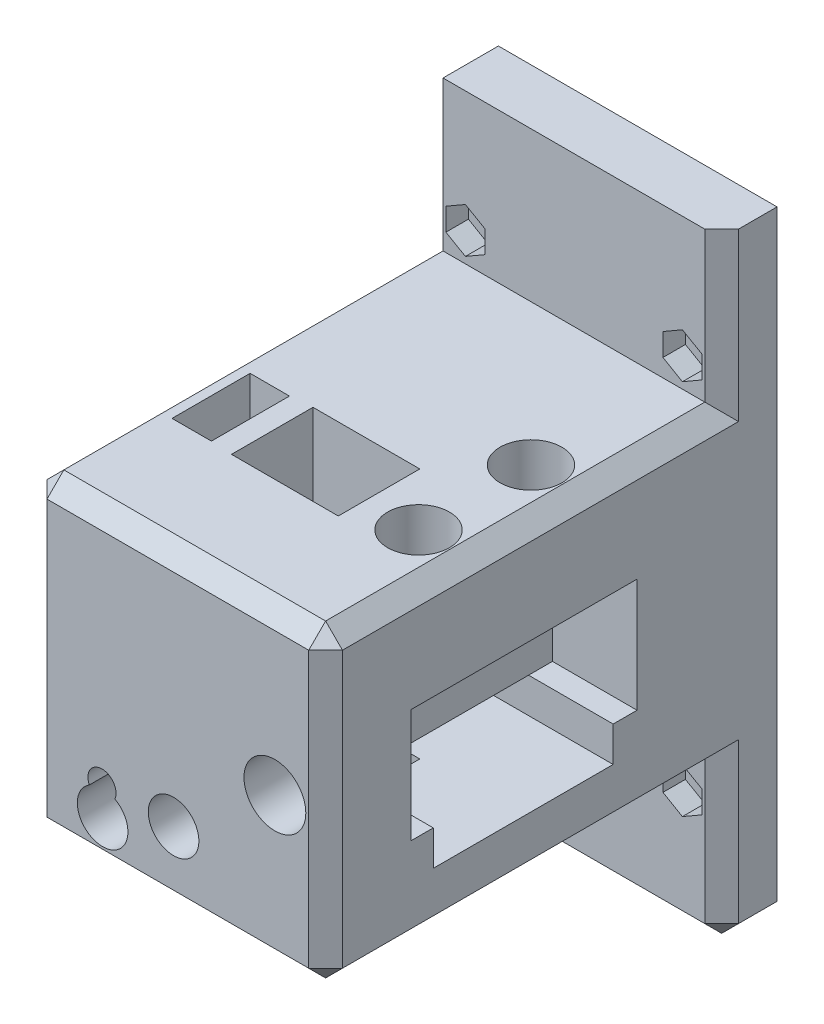
from build123d import *

# Parameters (mm, degrees)
SKETCH1_W                = 34.3
SKETCH1_H                = 70.3
SKETCH1_W_2              = 110
SKETCH1_H_2              = 9.85
BOSS_EXTRUDE1_DEPTH      = 15.048264774
BOSS_EXTRUDE3_DEPTH      = 10
BOSS_EXTRUDE4_DEPTH      = 27.518264774
CUT_EXTRUDE1_DEPTH       = 97.82308708
CUT_EXTRUDE1_DEPTH_BACK  = 97.82308708
SKETCH4_R                = 2
CUT_EXTRUDE3_DEPTH       = 77.2053469
CUT_EXTRUDE3_DEPTH_BACK  = 77.2053469
SKETCH8_W                = 129.903835659
SKETCH8_H                = 83.627886417
SKETCH9_W                = 44.357950904
SKETCH9_H                = 70.607950904
SKETCH9_W_2              = 20
SKETCH9_H_2              = 40
BOSS_EXTRUDE5_DEPTH      = 15.048264774
SKETCH10_W               = 20.2
SKETCH10_H               = 40.2
SKETCH10_W_2             = 20
SKETCH10_H_2             = 40
CUT_EXTRUDE6_DEPTH       = 81.359319258
SKETCH11_R               = 3
CUT_EXTRUDE7_DEPTH       = 30
CUT_EXTRUDE8_DEPTH       = 105.313703151
CUT_EXTRUDE8_DEPTH_BACK  = 8
SKETCH12_R               = 5.5
CUT_EXTRUDE10_DEPTH      = 81.359319258
CUT_EXTRUDE10_DEPTH_BACK = 81.359319258
SKETCH14_W               = 7.032197939
SKETCH14_H               = 32
SKETCH19_W               = 44.357950904
SKETCH19_H               = 70.453975452
BOSS_EXTRUDE9_DEPTH      = 3
BOSS_EXTRUDE6_DEPTH      = 19.3
SKETCH16_R               = 3.4
BOSS_EXTRUDE7_DEPTH      = 2.1
BOSS_EXTRUDE8_DEPTH      = 16.35
SKETCH20_R               = 3.4
BOSS_EXTRUDE10_DEPTH     = 0.5
SKETCH21_W               = 18.048264774
SKETCH21_H               = 5.321024548
BOSS_EXTRUDE11_DEPTH     = 14.5
BOSS_EXTRUDE12_START     = 0.5
SKETCH24_R               = 3.4
BOSS_EXTRUDE12_DEPTH     = 0.5
CUT_EXTRUDE11_START      = -0.25
SKETCH25_R               = 3.4
CUT_EXTRUDE11_DEPTH      = 0.25
SKETCH26_R               = 3.4
BOSS_EXTRUDE13_DEPTH     = 1
BOSS_EXTRUDE14_DEPTH     = 20.303975452
CUT_EXTRUDE12_DEPTH      = 4
SKETCH29_R               = 5.5
CUT_EXTRUDE13_DEPTH      = 8
SKETCH30_R               = 3
CUT_EXTRUDE14_DEPTH      = 26
CUT_EXTRUDE15_DEPTH      = 626.267941866
CUT_EXTRUDE15_DEPTH_BACK = 626.267941866
SKETCH31_W               = 192.459482296
SKETCH31_H               = 197.325031006
SKETCH31_W_2             = 7.003218593
SKETCH31_H_2             = 13.886852379
CUT_EXTRUDE16_DEPTH      = 626.668982681
CUT_EXTRUDE16_DEPTH_BACK = 626.668982681
SKETCH32_R               = 2.5
CUT_EXTRUDE17_DEPTH      = 626.668982681
CUT_EXTRUDE17_DEPTH_BACK = 16
SKETCH33_R               = 4.5
SKETCH34_R               = 4.5
CUT_EXTRUDE18_DEPTH      = 12
CUT_EXTRUDE19_DEPTH      = 20
CUT_EXTRUDE20_DEPTH      = 13


with BuildPart() as part:
    # Sketch1 → Boss-Extrude1 (new body)
    # profile 1 of 2: a face of its own
    with BuildSketch(Plane.YZ):
        Rectangle(SKETCH1_W, SKETCH1_H)
        with BuildLine():
            Line((-10.15, 6.7), (-10.15, -6.7))
            ThreePointArc((-10.15, -6.7), (-9.871751442, -7.371751442), (-9.2, -7.65))
            Line((-9.2, -7.65), (-8.5, -7.65))
            ThreePointArc((-8.5, -7.65), (-8.181801948, -7.518198052), (-8.05, -7.2))
            Line((-8.05, -7.2), (-8.05, -5.094911614))
            ThreePointArc((-8.05, -5.094911614), (-7.621019548, -4.452896997), (-6.863711672, -4.603534899))
            Line((-6.863711672, -4.603534899), (-4.684745674, -6.782500897))
            ThreePointArc((-4.684745674, -6.782500897), (-4.066943332, -7.707107441), (-3.85, -8.797755224))
            Line((-3.85, -8.797755224), (-3.85, -11.202244776))
            ThreePointArc((-3.85, -11.202244776), (-4.066943332, -12.292892559), (-4.684745674, -13.217499103))
            Line((-4.684745674, -13.217499103), (-6.863711672, -15.396465101))
            ThreePointArc((-6.863711672, -15.396465101), (-7.621019548, -15.547103003), (-8.05, -14.905088386))
            Line((-8.05, -14.905088386), (-8.05, -12.8))
            ThreePointArc((-8.05, -12.8), (-8.181801948, -12.481801948), (-8.5, -12.35))
            Line((-8.5, -12.35), (-9.2, -12.35))
            ThreePointArc((-9.2, -12.35), (-9.871751442, -12.628248558), (-10.15, -13.3))
            Line((-10.15, -13.3), (-10.15, -18))
            ThreePointArc((-10.15, -18), (-9.52027958, -19.52027958), (-8, -20.15))
            Line((-8, -20.15), (-3.3, -20.15))
            ThreePointArc((-3.3, -20.15), (-2.628248558, -19.871751442), (-2.35, -19.2))
            Line((-2.35, -19.2), (-2.35, -18.5))
            ThreePointArc((-2.35, -18.5), (-2.481801948, -18.181801948), (-2.8, -18.05))
            Line((-2.8, -18.05), (-4.905088386, -18.05))
            ThreePointArc((-4.905088386, -18.05), (-5.547103003, -17.621019548), (-5.396465101, -16.863711672))
            Line((-5.396465101, -16.863711672), (-3.217499103, -14.684745674))
            ThreePointArc((-3.217499103, -14.684745674), (-2.292892559, -14.066943332), (-1.202244776, -13.85))
            Line((-1.202244776, -13.85), (1.202244776, -13.85))
            ThreePointArc((1.202244776, -13.85), (2.292892559, -14.066943332), (3.217499103, -14.684745674))
            Line((3.217499103, -14.684745674), (5.396465101, -16.863711672))
            ThreePointArc((5.396465101, -16.863711672), (5.547103003, -17.621019548), (4.905088386, -18.05))
            Line((4.905088386, -18.05), (2.8, -18.05))
            ThreePointArc((2.8, -18.05), (2.481801948, -18.181801948), (2.35, -18.5))
            Line((2.35, -18.5), (2.35, -19.2))
            ThreePointArc((2.35, -19.2), (2.628248558, -19.871751442), (3.3, -20.15))
            Line((3.3, -20.15), (8, -20.15))
            ThreePointArc((8, -20.15), (9.52027958, -19.52027958), (10.15, -18))
            Line((10.15, -18), (10.15, -13.3))
            ThreePointArc((10.15, -13.3), (9.871751442, -12.628248558), (9.2, -12.35))
            Line((9.2, -12.35), (8.5, -12.35))
            ThreePointArc((8.5, -12.35), (8.181801948, -12.481801948), (8.05, -12.8))
            Line((8.05, -12.8), (8.05, -14.905088386))
            ThreePointArc((8.05, -14.905088386), (7.621019548, -15.547103003), (6.863711672, -15.396465101))
            Line((6.863711672, -15.396465101), (4.684745674, -13.217499103))
            ThreePointArc((4.684745674, -13.217499103), (4.066943332, -12.292892559), (3.85, -11.202244776))
            Line((3.85, -11.202244776), (3.85, -8.797755224))
            ThreePointArc((3.85, -8.797755224), (4.066943332, -7.707107441), (4.684745674, -6.782500897))
            Line((4.684745674, -6.782500897), (6.863711672, -4.603534899))
            ThreePointArc((6.863711672, -4.603534899), (7.621019548, -4.452896997), (8.05, -5.094911614))
            Line((8.05, -5.094911614), (8.05, -7.2))
            ThreePointArc((8.05, -7.2), (8.181801948, -7.518198052), (8.5, -7.65))
            Line((8.5, -7.65), (9.2, -7.65))
            ThreePointArc((9.2, -7.65), (9.871751442, -7.371751442), (10.15, -6.7))
            Line((10.15, -6.7), (10.15, 6.7))
            ThreePointArc((10.15, 6.7), (9.871751442, 7.371751442), (9.2, 7.65))
            Line((9.2, 7.65), (8.5, 7.65))
            ThreePointArc((8.5, 7.65), (8.181801948, 7.518198052), (8.05, 7.2))
            Line((8.05, 7.2), (8.05, 5.094911614))
            ThreePointArc((8.05, 5.094911614), (7.621019548, 4.452896997), (6.863711672, 4.603534899))
            Line((6.863711672, 4.603534899), (4.684745674, 6.782500897))
            ThreePointArc((4.684745674, 6.782500897), (4.066943332, 7.707107441), (3.85, 8.797755224))
            Line((3.85, 8.797755224), (3.85, 11.202244776))
            ThreePointArc((3.85, 11.202244776), (4.066943332, 12.292892559), (4.684745674, 13.217499103))
            Line((4.684745674, 13.217499103), (6.863711672, 15.396465101))
            ThreePointArc((6.863711672, 15.396465101), (7.621019548, 15.547103003), (8.05, 14.905088386))
            Line((8.05, 14.905088386), (8.05, 12.8))
            ThreePointArc((8.05, 12.8), (8.181801948, 12.481801948), (8.5, 12.35))
            Line((8.5, 12.35), (9.2, 12.35))
            ThreePointArc((9.2, 12.35), (9.871751442, 12.628248558), (10.15, 13.3))
            Line((10.15, 13.3), (10.15, 18))
            ThreePointArc((10.15, 18), (9.52027958, 19.52027958), (8, 20.15))
            Line((8, 20.15), (3.3, 20.15))
            ThreePointArc((3.3, 20.15), (2.628248558, 19.871751442), (2.35, 19.2))
            Line((2.35, 19.2), (2.35, 18.5))
            ThreePointArc((2.35, 18.5), (2.481801948, 18.181801948), (2.8, 18.05))
            Line((2.8, 18.05), (4.905088386, 18.05))
            ThreePointArc((4.905088386, 18.05), (5.547103003, 17.621019548), (5.396465101, 16.863711672))
            Line((5.396465101, 16.863711672), (3.217499103, 14.684745674))
            ThreePointArc((3.217499103, 14.684745674), (2.292892559, 14.066943332), (1.202244776, 13.85))
            Line((1.202244776, 13.85), (-1.202244776, 13.85))
            ThreePointArc((-1.202244776, 13.85), (-2.292892559, 14.066943332), (-3.217499103, 14.684745674))
            Line((-3.217499103, 14.684745674), (-5.396465101, 16.863711672))
            ThreePointArc((-5.396465101, 16.863711672), (-5.547103003, 17.621019548), (-4.905088386, 18.05))
            Line((-4.905088386, 18.05), (-2.8, 18.05))
            ThreePointArc((-2.8, 18.05), (-2.481801948, 18.181801948), (-2.35, 18.5))
            Line((-2.35, 18.5), (-2.35, 19.2))
            ThreePointArc((-2.35, 19.2), (-2.628248558, 19.871751442), (-3.3, 20.15))
            Line((-3.3, 20.15), (-8, 20.15))
            ThreePointArc((-8, 20.15), (-9.52027958, 19.52027958), (-10.15, 18))
            Line((-10.15, 18), (-10.15, 13.3))
            ThreePointArc((-10.15, 13.3), (-9.871751442, 12.628248558), (-9.2, 12.35))
            Line((-9.2, 12.35), (-8.5, 12.35))
            ThreePointArc((-8.5, 12.35), (-8.181801948, 12.481801948), (-8.05, 12.8))
            Line((-8.05, 12.8), (-8.05, 14.905088386))
            ThreePointArc((-8.05, 14.905088386), (-7.621019548, 15.547103003), (-6.863711672, 15.396465101))
            Line((-6.863711672, 15.396465101), (-4.684745674, 13.217499103))
            ThreePointArc((-4.684745674, 13.217499103), (-4.066943332, 12.292892559), (-3.85, 11.202244776))
            Line((-3.85, 11.202244776), (-3.85, 8.797755224))
            ThreePointArc((-3.85, 8.797755224), (-4.066943332, 7.707107441), (-4.684745674, 6.782500897))
            Line((-4.684745674, 6.782500897), (-6.863711672, 4.603534899))
            ThreePointArc((-6.863711672, 4.603534899), (-7.621019548, 4.452896997), (-8.05, 5.094911614))
            Line((-8.05, 5.094911614), (-8.05, 7.2))
            ThreePointArc((-8.05, 7.2), (-8.181801948, 7.518198052), (-8.5, 7.65))
            Line((-8.5, 7.65), (-9.2, 7.65))
            ThreePointArc((-9.2, 7.65), (-9.871751442, 7.371751442), (-10.15, 6.7))
        make_face(mode=Mode.SUBTRACT)
    # profile 2 of 2: a face of its own
    with BuildSketch(Plane.YZ):
        with Locations((0, -40.075)):
            Rectangle(SKETCH1_W_2, SKETCH1_H_2)
    extrude(amount=-BOSS_EXTRUDE1_DEPTH)

    # Sketch2 → Boss-Extrude3 (add)
    with BuildSketch(Plane.YZ):
        Polygon((17.15, 35.15), (-17.15, 35.15), (-17.15, -35.15), (-55, -35.15), (-55, -45), (55, -45), (55, -35.15), (17.15, -35.15), align=None)
    extrude(amount=BOSS_EXTRUDE3_DEPTH)

    # Sketch3 → Boss-Extrude4 (add)
    with BuildSketch(Plane.YZ.offset(10)):
        Polygon((-17.15, -35.15), (17.15, -35.15), (55, -35.15), (55, -45), (-55, -45), (-55, -35.15), align=None)
    extrude(amount=BOSS_EXTRUDE4_DEPTH)

    # Sketch4 → Cut-Extrude1 (cut, two sides: drawn at the far end of the back side and taken through both)
    with BuildSketch(Plane.XY.offset(-35.15).offset(-CUT_EXTRUDE1_DEPTH_BACK)):
        with Locations((-8.06818722, 33.5)):
            Circle(SKETCH4_R)
        with Locations((-8.06818722, -33.5)):
            Circle(SKETCH4_R)
        with Locations((30.53818722, -33.5)):
            Circle(SKETCH4_R)
        with Locations((30.53818722, 33.5)):
            Circle(SKETCH4_R)
    extrude(amount=CUT_EXTRUDE1_DEPTH + CUT_EXTRUDE1_DEPTH_BACK, mode=Mode.SUBTRACT)

    # Sketch8 → Cut-Extrude3 (cut, two sides: drawn at the far end of the back side and taken through both)
    with BuildSketch(Plane.YZ.offset(10).offset(-CUT_EXTRUDE3_DEPTH_BACK)):
        with Locations((-9.95191783, 6.663943208)):
            Rectangle(SKETCH8_W, SKETCH8_H)
    extrude(amount=CUT_EXTRUDE3_DEPTH + CUT_EXTRUDE3_DEPTH_BACK, mode=Mode.SUBTRACT)

    # Sketch9 → Boss-Extrude5 (add)
    with BuildSketch(Plane(origin=(-15.048264774, 0, 0), x_dir=(0, -1, 0), z_dir=(-1, 0, 0))):
        with Locations((-0.848975452, 0)):
            Rectangle(SKETCH9_W, SKETCH9_H)
        Rectangle(SKETCH9_W_2, SKETCH9_H_2, mode=Mode.SUBTRACT)
    extrude(amount=-BOSS_EXTRUDE5_DEPTH)

    # Sketch10 → Cut-Extrude6 (cut, through all)
    with BuildSketch(Plane.YZ):
        Rectangle(SKETCH10_W, SKETCH10_H)
        Rectangle(SKETCH10_W_2, SKETCH10_H_2, mode=Mode.SUBTRACT)
    extrude(amount=-CUT_EXTRUDE6_DEPTH, mode=Mode.SUBTRACT)

    # Sketch11 → Cut-Extrude7 (cut)
    with BuildSketch(Plane.XY.offset(35.303975452)):
        with Locations((-6.024132387, 0)):
            Circle(SKETCH11_R)
    extrude(amount=-CUT_EXTRUDE7_DEPTH, mode=Mode.SUBTRACT)

    # Sketch12 → Cut-Extrude8 (cut, two sides: drawn at the far end of the back side and taken through both)
    with BuildSketch(Plane.XY.offset(35.303975452).offset(-CUT_EXTRUDE8_DEPTH_BACK)):
        with Locations((-6.024132387, 0)):
            Circle(SKETCH12_R)
    extrude(amount=CUT_EXTRUDE8_DEPTH + CUT_EXTRUDE8_DEPTH_BACK, mode=Mode.SUBTRACT)

    # Sketch14 → Cut-Extrude10 (cut, two sides: drawn at the far end of the back side and taken through both)
    with BuildSketch(Plane.YZ.offset(-CUT_EXTRUDE10_DEPTH_BACK)):
        with Locations((-12.813901031, 0.15)):
            Rectangle(SKETCH14_W, SKETCH14_H)
    extrude(amount=CUT_EXTRUDE10_DEPTH + CUT_EXTRUDE10_DEPTH_BACK, mode=Mode.SUBTRACT)

    # Sketch19 → Boss-Extrude9 (add)
    # profile 1 of 2: a face of its own
    with BuildSketch(Plane.YZ):
        with Locations((0.848975452, 0.076987726)):
            Rectangle(SKETCH19_W, SKETCH19_H)
        Polygon((-16.33, -15.85), (-16.33, 16.15), (-10.1, 16.15), (-10.1, 20.1), (10.1, 20.1), (10.1, -20.1), (-10.1, -20.1), (-10.1, -15.85), align=None, mode=Mode.SUBTRACT)
    # profile 2 of 2: a face of its own
    with BuildSketch(Plane.YZ):
        Polygon((-10.1, 16.15), (-10.1, -15.85), (-10.1, -20.1), (10.1, -20.1), (10.1, 20.1), (-10.1, 20.1), align=None)
    extrude(amount=BOSS_EXTRUDE9_DEPTH)

    # Sketch15 → Boss-Extrude6 (add)
    with BuildSketch(Plane.XY.offset(-35.15)):
        Polygon((37.518264774, 28.348975452), (-15.048264774, 28.348975452), (-15.048264774, 23.027950904), (3, 23.027950904), (3, -21.33), (-15.048264774, -21.33), (-15.048264774, -26.651024548), (37.518264774, -26.651024548), align=None)
    extrude(amount=BOSS_EXTRUDE6_DEPTH)

    # Sketch16 → Boss-Extrude7 (add)
    with BuildSketch(Plane.XY.offset(-15.85)):
        with Locations(Location((24.73, -13.83, 0), (0, 0, 180))):
            Circle(SKETCH16_R)
    extrude(amount=BOSS_EXTRUDE7_DEPTH)

    # Sketch18 → Boss-Extrude8 (add)
    with BuildSketch(Plane.XY.offset(-15.85)):
        Polygon((14.73, -16.33), (3, -16.33), (3, -21.33), (-15.048264774, -21.33), (-15.048264774, -26.651024548), (14.73, -26.651024548), (14.73, -18.73), align=None)
        with BuildLine():
            Line((3, 23.027950904), (3, -10.1))
            Line((3, -10.1), (24.091429665, -8.750409431))
            ThreePointArc((24.091429665, -8.750409431), (31.571574988, -11.43665703), (34.73, -18.73))
            Line((34.73, -18.73), (34.73, -26.651024548))
            Line((34.73, -26.651024548), (37.518264774, -26.651024548))
            Line((37.518264774, -26.651024548), (37.518264774, 28.348975452))
            Line((37.518264774, 28.348975452), (-15.048264774, 28.348975452))
            Line((-15.048264774, 28.348975452), (-15.048264774, 23.027950904))
            Line((-15.048264774, 23.027950904), (3, 23.027950904))
        make_face()
    extrude(amount=BOSS_EXTRUDE8_DEPTH)

    # Sketch20 → Boss-Extrude10 (add)
    with BuildSketch(Plane.XY.offset(0.5)):
        with Locations(Location((12, -28.33, 0), (0, 0, 150.408273311))):
            Circle(SKETCH20_R)
    extrude(amount=BOSS_EXTRUDE10_DEPTH)

    # Sketch21 → Boss-Extrude11 (add)
    with BuildSketch(Plane.XY.offset(0.5)):
        with BuildLine():
            Line((22, 28.348975452), (22, -8.884235056))
            Line((22, -8.884235056), (24.091429665, -8.750409431))
            ThreePointArc((24.091429665, -8.750409431), (31.571574988, -11.43665703), (34.73, -18.73))
            Line((34.73, -18.73), (34.73, -26.651024548))
            Line((34.73, -26.651024548), (37.518264774, -26.651024548))
            Line((37.518264774, -26.651024548), (37.518264774, 28.348975452))
            Line((37.518264774, 28.348975452), (22, 28.348975452))
        make_face()
        with BuildLine():
            Line((-15.048264774, -26.651024548), (2.141955497, -26.651024548))
            ThreePointArc((2.141955497, -26.651024548), (3.136652725, -23.69954915), (4.991150442, -21.197256637))
            Line((4.991150442, -21.197256637), (3, -16.33))
            Line((3, -16.33), (3, -21.33))
            Line((3, -21.33), (-15.048264774, -21.33))
            Line((-15.048264774, -21.33), (-15.048264774, -26.651024548))
        make_face()
        with Locations((-6.024132387, 25.688463178)):
            Rectangle(SKETCH21_W, SKETCH21_H)
    extrude(amount=BOSS_EXTRUDE11_DEPTH)

    # Sketch25 → Cut-Extrude11 (cut)
    with BuildSketch(Plane.XY.offset(-13.75).offset(CUT_EXTRUDE11_START)):
        with Locations(Location((24.73, -13.83, 0), (0, 0, 180))):
            Circle(SKETCH25_R)
    extrude(amount=CUT_EXTRUDE11_DEPTH, mode=Mode.SUBTRACT)



with BuildPart() as body_2:
    # Sketch24 → Boss-Extrude12 (new body)
    with BuildSketch(Plane.YX.offset(-0.5).offset(BOSS_EXTRUDE12_START)):
        with Locations(Location((-13.83, 24.73, 0), (0, 0, 270))):
            Circle(SKETCH24_R)
    extrude(amount=-BOSS_EXTRUDE12_DEPTH)


with BuildPart() as body_3:
    # Sketch26 → Boss-Extrude13 (new body)
    with BuildSketch(Plane(origin=(0, 0, 14), x_dir=(0, -1, 0), z_dir=(0, 0, 1))):
        with Locations(Location((28.33, 12, 0), (0, 0, 240.408273311))):
            Circle(SKETCH26_R)
    extrude(amount=BOSS_EXTRUDE13_DEPTH)


with BuildPart() as part_1:
    add(part.part)

    add(body_3.part)  # Boss-Extrude14 merges body 3
    # Sketch27 → Boss-Extrude14 (add)
    with BuildSketch(Plane.XY.offset(15)):
        Polygon((-15.048264774, -21.33), (-15.048264774, -26.651024548), (37.518264774, -26.651024548), (37.518264774, 28.348975452), (-15.048264774, 28.348975452), (-15.048264774, 23.027950904), (3, 23.027950904), (3, -21.33), align=None)
    extrude(amount=BOSS_EXTRUDE14_DEPTH)

    # Chamfer1
    # the kernel refuses this chamfer: 3 mm, written as the material it takes off along each edge
    with BuildSketch(Plane(origin=(-13.048264774, 26.348975452, 33.303975452), x_dir=(0.7071067812061043, 0.7071067811669909, 0), z_dir=(-0.5773502691639131, 0.577350269195849, 0.5773502692091153)), Plane(origin=(35.518264774, 26.348975452, 33.303975452), x_dir=(0.707106781206494, -0.707106781166601, 0), z_dir=(0.5773502691634868, 0.5773502691960591, 0.5773502692093315)), Plane(origin=(-13.048264774, -24.651024548, 33.303975452), x_dir=(0.707106781214228, 0, 0.7071067811588669), z_dir=(-0.5773502691639134, -0.5773502691958485, 0.5773502692091155)), Plane(origin=(-13.048264774, -53, -37.15), x_dir=(0, -0.7071067811865467, -0.7071067811865483), z_dir=(-0.5773502691896262, -0.5773502691896262, 0.5773502691896248))) as chamfer1_piece_1:
        Polygon((-2.121320344, 1.224744871), (2.121320344, 1.224744871), (0, -2.449489743), align=None)
    extrude(amount=3.810511777, mode=Mode.SUBTRACT)
    with BuildSketch(Plane(origin=(35.518264774, -24.651024548, 33.303975452), x_dir=(-0.7071067812146217, 0, 0.7071067811584735), z_dir=(0.5773502691634868, -0.5773502691960591, 0.5773502692093315)), Plane(origin=(35.518264774, -53, -37.15), x_dir=(0, -0.7071067811865467, -0.7071067811865483), z_dir=(0.5773502691896262, -0.5773502691896262, 0.5773502691896248))) as chamfer1_piece_2:
        Polygon((-2.121320344, -1.224744871), (2.121320344, -1.224744871), (0, 2.449489743), align=None)
    extrude(amount=3.810511777, mode=Mode.SUBTRACT)
    with BuildSketch(Plane(origin=(-15.048264774, 28.348975452, -35.15), x_dir=(-0.02749587661058619, 0, -0.9996219169112968), z_dir=(0, 1, 0))) as chamfer1_piece_3:
        with BuildLine():
            Line((3.086019586, 0), (-0.169641465, -3.081353381))
            Line((-0.169641465, -3.081353381), (-0.22961878, -3.079703628))
            ThreePointArc((-0.22961878, -3.079703628), (-0.102387681, -1.540193489), (-0.059977315, 0.001649753))
            Line((-0.059977315, 0.001649753), (0.001649753, 0.059977315))
            ThreePointArc((0.001649753, 0.059977315), (1.543492994, 0.017566949), (3.087669338, 0.059977315))
            Line((3.087669338, 0.059977315), (3.086019586, 0))
        make_face()
    extrude(amount=34.366073512, mode=Mode.SUBTRACT)
    with BuildSketch(Plane(origin=(-15.048264774, 28.348975452, 43.019024416), x_dir=(-0.02749587661058619, -0.9996219169112968, 0), z_dir=(0, 0, -1)), Plane(origin=(37.518264774, 28.348975452, -35.15), x_dir=(0.027495876666186494, -0.9996219169097673, 0), z_dir=(0, 0, 1)), Plane(origin=(37.518264774, -26.651024548, 43.019024416), x_dir=(0.027495876610586768, 0.9996219169112968, 0), z_dir=(0, 0, -1)), Plane(origin=(-15.048264774, -26.651024548, -35.15), x_dir=(-0.027495876665117977, 0.9996219169097968, 0), z_dir=(0, 0, 1))) as chamfer1_piece_4:
        with BuildLine():
            Line((3.086019586, 0), (-0.169641465, -3.081353381))
            Line((-0.169641465, -3.081353381), (-0.22961878, -3.079703628))
            ThreePointArc((-0.22961878, -3.079703628), (-0.102387681, -1.540193489), (-0.059977315, 0.001649753))
            Line((-0.059977315, 0.001649753), (0.001649753, 0.059977315))
            ThreePointArc((0.001649753, 0.059977315), (1.543492994, 0.017566949), (3.087669338, 0.059977315))
            Line((3.087669338, 0.059977315), (3.086019586, 0))
        make_face()
    extrude(amount=78.169024416, mode=Mode.SUBTRACT)
    with BuildSketch(Plane(origin=(-22.763313738, -26.651024548, 35.303975452), x_dir=(0, 0.9996219169112965, 0.02749587661058676), z_dir=(1, 0, 0))) as chamfer1_piece_5:
        with BuildLine():
            Line((3.086019586, 0), (-0.169641465, -3.081353381))
            Line((-0.169641465, -3.081353381), (-0.22961878, -3.079703628))
            ThreePointArc((-0.22961878, -3.079703628), (-0.102387681, -1.540193489), (-0.059977315, 0.001649753))
            Line((-0.059977315, 0.001649753), (0.001649753, 0.059977315))
            ThreePointArc((0.001649753, 0.059977315), (1.543492994, 0.017566949), (3.087669338, 0.059977315))
            Line((3.087669338, 0.059977315), (3.086019586, 0))
        make_face()
    extrude(amount=67.996627475, mode=Mode.SUBTRACT)
    with BuildSketch(Plane(origin=(45.233313738, 28.348975452, 35.303975452), x_dir=(0, 0.027495876610586768, -0.9996219169112968), z_dir=(-1, 0, 0))) as chamfer1_piece_6:
        with BuildLine():
            Line((3.086019586, 0), (-0.169641465, 3.081353381))
            Line((-0.169641465, 3.081353381), (-0.22961878, 3.079703628))
            ThreePointArc((-0.22961878, 3.079703628), (-0.102387681, 1.540193489), (-0.059977315, -0.001649753))
            Line((-0.059977315, -0.001649753), (0.001649753, -0.059977315))
            ThreePointArc((0.001649753, -0.059977315), (1.543492994, -0.017566949), (3.087669338, -0.059977315))
            Line((3.087669338, -0.059977315), (3.086019586, 0))
        make_face()
    extrude(amount=67.996627475, mode=Mode.SUBTRACT)
    with BuildSketch(Plane(origin=(45.233313738, -55, -35.15), x_dir=(0, -0.027495876610586768, -0.9996219169112968), z_dir=(-1, 0, 0))) as chamfer1_piece_7:
        with BuildLine():
            Line((3.086019586, 0), (-0.169641465, -3.081353381))
            Line((-0.169641465, -3.081353381), (-0.22961878, -3.079703628))
            ThreePointArc((-0.22961878, -3.079703628), (-0.102387681, -1.540193489), (-0.059977315, 0.001649753))
            Line((-0.059977315, 0.001649753), (0.001649753, 0.059977315))
            ThreePointArc((0.001649753, 0.059977315), (1.543492994, 0.017566949), (3.087669338, 0.059977315))
            Line((3.087669338, 0.059977315), (3.086019586, 0))
        make_face()
    extrude(amount=67.996627476, mode=Mode.SUBTRACT)
    with BuildSketch(Plane(origin=(-15.048264774, 23.027950904, 35.303975452), x_dir=(-0.027495876665116284, 0, -0.9996219169097968), z_dir=(0, -1, 0))) as chamfer1_piece_8:
        with BuildLine():
            Line((3.086019586, 0), (-0.169641465, 3.081353381))
            Line((-0.169641465, 3.081353381), (-0.22961878, 3.079703628))
            ThreePointArc((-0.22961878, 3.079703628), (-0.102387681, 1.540193489), (-0.059977315, -0.001649753))
            Line((-0.059977315, -0.001649753), (0.001649753, -0.059977315))
            ThreePointArc((0.001649753, -0.059977315), (1.543492994, -0.017566949), (3.087669338, -0.059977315))
            Line((3.087669338, -0.059977315), (3.086019586, 0))
        make_face()
    extrude(amount=44.357950904, mode=Mode.SUBTRACT)
    with BuildSketch(Plane(origin=(37.518264774, -34.366073512, 35.303975452), x_dir=(0.027495876610586768, 0, -0.9996219169112968), z_dir=(0, 1, 0))) as chamfer1_piece_9:
        with BuildLine():
            Line((3.086019586, 0), (-0.169641465, 3.081353381))
            Line((-0.169641465, 3.081353381), (-0.22961878, 3.079703628))
            ThreePointArc((-0.22961878, 3.079703628), (-0.102387681, 1.540193489), (-0.059977315, -0.001649753))
            Line((-0.059977315, -0.001649753), (0.001649753, -0.059977315))
            ThreePointArc((0.001649753, -0.059977315), (1.543492994, -0.017566949), (3.087669338, -0.059977315))
            Line((3.087669338, -0.059977315), (3.086019586, 0))
        make_face()
    extrude(amount=70.430097928, mode=Mode.SUBTRACT)
    with BuildSketch(Plane(origin=(-15.048264774, -62.715048964, -35.15), x_dir=(-0.02749587661058619, 0, -0.9996219169112968), z_dir=(0, 1, 0))) as chamfer1_piece_10:
        with BuildLine():
            Line((3.086019586, 0), (-0.169641465, -3.081353381))
            Line((-0.169641465, -3.081353381), (-0.22961878, -3.079703628))
            ThreePointArc((-0.22961878, -3.079703628), (-0.102387681, -1.540193489), (-0.059977315, 0.001649753))
            Line((-0.059977315, 0.001649753), (0.001649753, 0.059977315))
            ThreePointArc((0.001649753, 0.059977315), (1.543492994, 0.017566949), (3.087669338, 0.059977315))
            Line((3.087669338, 0.059977315), (3.086019586, 0))
        make_face()
    extrude(amount=36.064024416, mode=Mode.SUBTRACT)
    with BuildSketch(Plane(origin=(-15.048264774, -55, -27.434951036), x_dir=(-0.02749587661058619, 0.9996219169112968, 0), z_dir=(0, 0, -1))) as chamfer1_piece_11:
        with BuildLine():
            Line((3.086019586, 0), (-0.169641465, 3.081353381))
            Line((-0.169641465, 3.081353381), (-0.22961878, 3.079703628))
            ThreePointArc((-0.22961878, 3.079703628), (-0.102387681, 1.540193489), (-0.059977315, -0.001649753))
            Line((-0.059977315, -0.001649753), (0.001649753, -0.059977315))
            ThreePointArc((0.001649753, -0.059977315), (1.543492994, -0.017566949), (3.087669338, -0.059977315))
            Line((3.087669338, -0.059977315), (3.086019586, 0))
        make_face()
    extrude(amount=25.280097928, mode=Mode.SUBTRACT)
    with BuildSketch(Plane(origin=(37.518264774, -55, -52.715048964), x_dir=(-0.9996219169112965, -0.02749587661058676, 0), z_dir=(0, 0, 1)), Plane(origin=(37.518264774, 55, -27.434951036), x_dir=(-0.9996219169112965, 0.02749587661058676, 0), z_dir=(0, 0, -1))) as chamfer1_piece_12:
        with BuildLine():
            Line((3.086019586, 0), (-0.169641465, -3.081353381))
            Line((-0.169641465, -3.081353381), (-0.22961878, -3.079703628))
            ThreePointArc((-0.22961878, -3.079703628), (-0.102387681, -1.540193489), (-0.059977315, 0.001649753))
            Line((-0.059977315, 0.001649753), (0.001649753, 0.059977315))
            ThreePointArc((0.001649753, 0.059977315), (1.543492994, 0.017566949), (3.087669338, 0.059977315))
            Line((3.087669338, 0.059977315), (3.086019586, 0))
        make_face()
    extrude(amount=25.280097928, mode=Mode.SUBTRACT)
    with BuildSketch(Plane(origin=(37.518264774, 28.348975452, -35.15), x_dir=(0.027495876610586768, 0, -0.9996219169112968), z_dir=(0, 1, 0))) as chamfer1_piece_13:
        with BuildLine():
            Line((3.086019586, 0), (-0.169641465, 3.081353381))
            Line((-0.169641465, 3.081353381), (-0.22961878, 3.079703628))
            ThreePointArc((-0.22961878, 3.079703628), (-0.102387681, 1.540193489), (-0.059977315, -0.001649753))
            Line((-0.059977315, -0.001649753), (0.001649753, -0.059977315))
            ThreePointArc((0.001649753, -0.059977315), (1.543492994, -0.017566949), (3.087669338, -0.059977315))
            Line((3.087669338, -0.059977315), (3.086019586, 0))
        make_face()
    extrude(amount=34.366073512, mode=Mode.SUBTRACT)
    with BuildSketch(Plane(origin=(37.518264774, -62.715048964, -35.15), x_dir=(0.027495876610586768, 0, -0.9996219169112968), z_dir=(0, 1, 0))) as chamfer1_piece_14:
        with BuildLine():
            Line((3.086019586, 0), (-0.169641465, 3.081353381))
            Line((-0.169641465, 3.081353381), (-0.22961878, 3.079703628))
            ThreePointArc((-0.22961878, 3.079703628), (-0.102387681, 1.540193489), (-0.059977315, -0.001649753))
            Line((-0.059977315, -0.001649753), (0.001649753, -0.059977315))
            ThreePointArc((0.001649753, -0.059977315), (1.543492994, -0.017566949), (3.087669338, -0.059977315))
            Line((3.087669338, -0.059977315), (3.086019586, 0))
        make_face()
    extrude(amount=36.064024416, mode=Mode.SUBTRACT)
    with BuildSketch(Plane(origin=(-15.048264774, 36.064024416, 35.303975452), x_dir=(-0.02749587661058619, 0, -0.9996219169112968), z_dir=(0, -1, 0)), Plane(origin=(-15.048264774, -21.33, 35.303975452), x_dir=(-0.02749587666542296, 0, -0.9996219169097883), z_dir=(0, -1, 0))) as chamfer1_piece_15:
        with BuildLine():
            Line((3.086019586, 0), (-0.169641465, 3.081353381))
            Line((-0.169641465, 3.081353381), (-0.22961878, 3.079703628))
            ThreePointArc((-0.22961878, 3.079703628), (-0.102387681, 1.540193489), (-0.059977315, -0.001649753))
            Line((-0.059977315, -0.001649753), (0.001649753, -0.059977315))
            ThreePointArc((0.001649753, -0.059977315), (1.543492994, -0.017566949), (3.087669338, -0.059977315))
            Line((3.087669338, -0.059977315), (3.086019586, 0))
        make_face()
    extrude(amount=13.036073512, mode=Mode.SUBTRACT)
    with BuildSketch(Plane(origin=(-15.048264774, 20.633926488, -35.15), x_dir=(-0.02749587661058619, 0, -0.9996219169112968), z_dir=(0, 1, 0))) as chamfer1_piece_16a_section:
        with BuildLine():
            Line((3.086019586, 0), (-0.169641465, -3.081353381))
            Line((-0.169641465, -3.081353381), (-0.22961878, -3.079703628))
            ThreePointArc((-0.22961878, -3.079703628), (-0.102387681, -1.540193489), (-0.059977315, 0.001649753))
            Line((-0.059977315, 0.001649753), (0.001649753, 0.059977315))
            ThreePointArc((0.001649753, 0.059977315), (1.543492994, 0.017566949), (3.087669338, 0.059977315))
            Line((3.087669338, 0.059977315), (3.086019586, 0))
        make_face()
    chamfer1_piece_16a = extrude(amount=42.081122476, mode=Mode.PRIVATE)
    chamfer1_piece_16a = split(chamfer1_piece_16a, bisect_by=Plane(origin=(-14.058883894, 28.348975452, -36.13938088), z_dir=(0, -1, 0)), keep=Keep.TOP, mode=Mode.PRIVATE)
    with BuildSketch(Plane(origin=(-15.048264774, 28.348975452, 43.019024416), x_dir=(-0.02749587661058619, -0.9996219169112968, 0), z_dir=(0, 0, -1))) as chamfer1_piece_16b_section:
        with BuildLine():
            Line((3.086019586, 0), (-0.169641465, -3.081353381))
            Line((-0.169641465, -3.081353381), (-0.22961878, -3.079703628))
            ThreePointArc((-0.22961878, -3.079703628), (-0.102387681, -1.540193489), (-0.059977315, 0.001649753))
            Line((-0.059977315, 0.001649753), (0.001649753, 0.059977315))
            ThreePointArc((0.001649753, 0.059977315), (1.543492994, 0.017566949), (3.087669338, 0.059977315))
            Line((3.087669338, 0.059977315), (3.086019586, 0))
        make_face()
    chamfer1_piece_16b = extrude(amount=85.88407338, mode=Mode.PRIVATE)
    chamfer1_piece_16b = split(chamfer1_piece_16b, bisect_by=Plane(origin=(-14.058883894, 27.359594572, -35.15), z_dir=(0, 0, -1)), keep=Keep.TOP, mode=Mode.PRIVATE)
    chamfer1_piece_16 = chamfer1_piece_16a & chamfer1_piece_16b
    add(chamfer1_piece_16, mode=Mode.SUBTRACT)
    with BuildSketch(Plane(origin=(37.518264774, 28.348975452, -42.865048964), x_dir=(0.027495876610586768, -0.9996219169112968, 0), z_dir=(0, 0, 1))) as chamfer1_piece_17a_section:
        with BuildLine():
            Line((3.086019586, 0), (-0.169641465, -3.081353381))
            Line((-0.169641465, -3.081353381), (-0.22961878, -3.079703628))
            ThreePointArc((-0.22961878, -3.079703628), (-0.102387681, -1.540193489), (-0.059977315, 0.001649753))
            Line((-0.059977315, 0.001649753), (0.001649753, 0.059977315))
            ThreePointArc((0.001649753, 0.059977315), (1.543492994, 0.017566949), (3.087669338, 0.059977315))
            Line((3.087669338, 0.059977315), (3.086019586, 0))
        make_face()
    chamfer1_piece_17a = extrude(amount=85.88407338, mode=Mode.PRIVATE)
    chamfer1_piece_17a = split(chamfer1_piece_17a, bisect_by=Plane(origin=(36.528883894, 27.359594572, -35.15), z_dir=(0, 0, -1)), keep=Keep.TOP, mode=Mode.PRIVATE)
    with BuildSketch(Plane(origin=(37.518264774, 20.633926488, -35.15), x_dir=(0.027495876610586768, 0, -0.9996219169112968), z_dir=(0, 1, 0))) as chamfer1_piece_17b_section:
        with BuildLine():
            Line((3.086019586, 0), (-0.169641465, 3.081353381))
            Line((-0.169641465, 3.081353381), (-0.22961878, 3.079703628))
            ThreePointArc((-0.22961878, 3.079703628), (-0.102387681, 1.540193489), (-0.059977315, -0.001649753))
            Line((-0.059977315, -0.001649753), (0.001649753, -0.059977315))
            ThreePointArc((0.001649753, -0.059977315), (1.543492994, -0.017566949), (3.087669338, -0.059977315))
            Line((3.087669338, -0.059977315), (3.086019586, 0))
        make_face()
    chamfer1_piece_17b = extrude(amount=42.081122476, mode=Mode.PRIVATE)
    chamfer1_piece_17b = split(chamfer1_piece_17b, bisect_by=Plane(origin=(36.528883894, 28.348975452, -36.13938088), z_dir=(0, -1, 0)), keep=Keep.TOP, mode=Mode.PRIVATE)
    chamfer1_piece_17 = chamfer1_piece_17a & chamfer1_piece_17b
    add(chamfer1_piece_17, mode=Mode.SUBTRACT)
    with BuildSketch(Plane(origin=(37.518264774, -62.715048964, -35.15), x_dir=(0.027495876610586768, 0, -0.9996219169112968), z_dir=(0, 1, 0))) as chamfer1_piece_18a_section:
        with BuildLine():
            Line((3.086019586, 0), (-0.169641465, 3.081353381))
            Line((-0.169641465, 3.081353381), (-0.22961878, 3.079703628))
            ThreePointArc((-0.22961878, 3.079703628), (-0.102387681, 1.540193489), (-0.059977315, -0.001649753))
            Line((-0.059977315, -0.001649753), (0.001649753, -0.059977315))
            ThreePointArc((0.001649753, -0.059977315), (1.543492994, -0.017566949), (3.087669338, -0.059977315))
            Line((3.087669338, -0.059977315), (3.086019586, 0))
        make_face()
    chamfer1_piece_18a = extrude(amount=43.77907338, mode=Mode.PRIVATE)
    chamfer1_piece_18a = split(chamfer1_piece_18a, bisect_by=Plane(origin=(36.528883894, -26.651024548, -36.13938088), z_dir=(0, 1, 0)), keep=Keep.TOP, mode=Mode.PRIVATE)
    with BuildSketch(Plane(origin=(37.518264774, -26.651024548, 43.019024416), x_dir=(0.027495876610586768, 0.9996219169112968, 0), z_dir=(0, 0, -1))) as chamfer1_piece_18b_section:
        with BuildLine():
            Line((3.086019586, 0), (-0.169641465, -3.081353381))
            Line((-0.169641465, -3.081353381), (-0.22961878, -3.079703628))
            ThreePointArc((-0.22961878, -3.079703628), (-0.102387681, -1.540193489), (-0.059977315, 0.001649753))
            Line((-0.059977315, 0.001649753), (0.001649753, 0.059977315))
            ThreePointArc((0.001649753, 0.059977315), (1.543492994, 0.017566949), (3.087669338, 0.059977315))
            Line((3.087669338, 0.059977315), (3.086019586, 0))
        make_face()
    chamfer1_piece_18b = extrude(amount=85.88407338, mode=Mode.PRIVATE)
    chamfer1_piece_18b = split(chamfer1_piece_18b, bisect_by=Plane(origin=(36.528883894, -25.661643668, -35.15), z_dir=(0, 0, -1)), keep=Keep.TOP, mode=Mode.PRIVATE)
    chamfer1_piece_18 = chamfer1_piece_18a & chamfer1_piece_18b
    add(chamfer1_piece_18, mode=Mode.SUBTRACT)
    with BuildSketch(Plane(origin=(-15.048264774, -62.715048964, -35.15), x_dir=(-0.02749587661058619, 0, -0.9996219169112968), z_dir=(0, 1, 0))) as chamfer1_piece_19a_section:
        with BuildLine():
            Line((3.086019586, 0), (-0.169641465, -3.081353381))
            Line((-0.169641465, -3.081353381), (-0.22961878, -3.079703628))
            ThreePointArc((-0.22961878, -3.079703628), (-0.102387681, -1.540193489), (-0.059977315, 0.001649753))
            Line((-0.059977315, 0.001649753), (0.001649753, 0.059977315))
            ThreePointArc((0.001649753, 0.059977315), (1.543492994, 0.017566949), (3.087669338, 0.059977315))
            Line((3.087669338, 0.059977315), (3.086019586, 0))
        make_face()
    chamfer1_piece_19a = extrude(amount=43.77907338, mode=Mode.PRIVATE)
    chamfer1_piece_19a = split(chamfer1_piece_19a, bisect_by=Plane(origin=(-14.058883894, -26.651024548, -36.13938088), z_dir=(0, 1, 0)), keep=Keep.TOP, mode=Mode.PRIVATE)
    with BuildSketch(Plane(origin=(-15.048264774, -26.651024548, -42.865048964), x_dir=(-0.02749587661058619, 0.9996219169112968, 0), z_dir=(0, 0, 1))) as chamfer1_piece_19b_section:
        with BuildLine():
            Line((3.086019586, 0), (-0.169641465, -3.081353381))
            Line((-0.169641465, -3.081353381), (-0.22961878, -3.079703628))
            ThreePointArc((-0.22961878, -3.079703628), (-0.102387681, -1.540193489), (-0.059977315, 0.001649753))
            Line((-0.059977315, 0.001649753), (0.001649753, 0.059977315))
            ThreePointArc((0.001649753, 0.059977315), (1.543492994, 0.017566949), (3.087669338, 0.059977315))
            Line((3.087669338, 0.059977315), (3.086019586, 0))
        make_face()
    chamfer1_piece_19b = extrude(amount=85.88407338, mode=Mode.PRIVATE)
    chamfer1_piece_19b = split(chamfer1_piece_19b, bisect_by=Plane(origin=(-14.058883894, -25.661643668, -35.15), z_dir=(0, 0, -1)), keep=Keep.TOP, mode=Mode.PRIVATE)
    chamfer1_piece_19 = chamfer1_piece_19a & chamfer1_piece_19b
    add(chamfer1_piece_19, mode=Mode.SUBTRACT)

    # Sketch28 → Cut-Extrude12 (cut)
    with BuildSketch(Plane.XY.offset(-35.15)):
        Polygon((-8.06818722, -37.5), (-4.604085605, -35.5), (-4.604085605, -31.5), (-8.06818722, -29.5), (-11.532288835, -31.5), (-11.532288835, -35.5), align=None)
        Polygon((34.002288835, -31.5), (30.53818722, -29.5), (27.074085604, -31.5), (27.074085604, -35.5), (30.53818722, -37.5), (34.002288835, -35.5), align=None)
        Polygon((-4.604085605, 31.5), (-4.604085605, 35.5), (-8.06818722, 37.5), (-11.532288835, 35.5), (-11.532288835, 31.5), (-8.06818722, 29.5), align=None)
        Polygon((34.002288835, 35.5), (30.53818722, 37.5), (27.074085604, 35.5), (27.074085604, 31.5), (30.53818722, 29.5), (34.002288835, 31.5), align=None)
    extrude(amount=-CUT_EXTRUDE12_DEPTH, mode=Mode.SUBTRACT)

    # Sketch29 → Cut-Extrude13 (cut)
    with BuildSketch(Plane(origin=(0, 28.348975452, 0), x_dir=(-1, 0, 0), z_dir=(0, 1, 0))):
        with Locations(Location((6.274132387, 10, 0), (0, 0, 90))):
            Circle(SKETCH29_R)
        with Locations(Location((6.274132387, -10, 0), (0, 0, 90))):
            Circle(SKETCH29_R)
    extrude(amount=-CUT_EXTRUDE13_DEPTH, mode=Mode.SUBTRACT)

    # Sketch30 → Cut-Extrude14 (cut)
    with BuildSketch(Plane(origin=(0, 20.348975452, 0), x_dir=(-1, 0, 0), z_dir=(0, 1, 0))):
        with Locations(Location((6.274132387, 10, 0), (0, 0, 90))):
            Circle(SKETCH30_R)
        with Locations(Location((6.274132387, -10, 0), (0, 0, 90))):
            Circle(SKETCH30_R)
    extrude(amount=-CUT_EXTRUDE14_DEPTH, mode=Mode.SUBTRACT)


with BuildPart() as body_3_2:
    # Mirror2: mirrored copy
    add(part_1.part.mirror(Plane(origin=(-290.266735226, 0, 0), x_dir=(0, 0, 1), z_dir=(1, 0, 0))))


with BuildPart() as cut_extrude15_tool:
    # Sketch31 → Cut-Extrude15 (new, two sides: drawn at the far end of the back side and taken through both)
    with BuildSketch(Plane(origin=(0, 28.348975452, 0), x_dir=(-1, 0, 0), z_dir=(0, 1, 0)).offset(-CUT_EXTRUDE15_DEPTH_BACK)):
        with Locations((-34.459800215, -31.230096754)):
            Rectangle(SKETCH31_W, SKETCH31_H)
        with Locations((609.858390704, 7.806573811)):
            Rectangle(SKETCH31_W_2, SKETCH31_H_2)
    extrude(amount=CUT_EXTRUDE15_DEPTH + CUT_EXTRUDE15_DEPTH_BACK)


with BuildPart() as part_2:
    add(part_1.part)

    # Cut-Extrude15: cut by cut_extrude15_tool
    add(cut_extrude15_tool.part, mode=Mode.SUBTRACT)


with BuildPart() as body_2_1:
    add(body_2.part)

    # Cut-Extrude15: cut by cut_extrude15_tool
    add(cut_extrude15_tool.part, mode=Mode.SUBTRACT)


with BuildPart() as body_3_2_1:
    add(body_3_2.part)

    # Cut-Extrude15: cut by cut_extrude15_tool
    add(cut_extrude15_tool.part, mode=Mode.SUBTRACT)

    # Sketch32 → Cut-Extrude16 (cut, two sides: drawn at the far end of the back side and taken through both)
    with BuildSketch(Plane.XY.offset(35.303975452).offset(-CUT_EXTRUDE16_DEPTH_BACK)):
        with Locations((-592.533470452, -28.33)):
            Circle(SKETCH32_R)
        with Locations((-605.263470452, -13.83)):
            Circle(SKETCH32_R)
    extrude(amount=CUT_EXTRUDE16_DEPTH + CUT_EXTRUDE16_DEPTH_BACK, mode=Mode.SUBTRACT)

    # Sketch33 → Cut-Extrude17 (cut, two sides: drawn at the far end of the back side and taken through both)
    with BuildSketch(Plane.XY.offset(35.303975452).offset(-CUT_EXTRUDE17_DEPTH_BACK)):
        with Locations((-605.148769837, -18.75)):
            Circle(SKETCH33_R)
    extrude(amount=CUT_EXTRUDE17_DEPTH + CUT_EXTRUDE17_DEPTH_BACK, mode=Mode.SUBTRACT)

    # Sketch34 → Cut-Extrude18 (cut)
    with BuildSketch(Plane.XY.offset(35.303975452)):
        with Locations((-592.53, -13.83)):
            Circle(SKETCH34_R)
    extrude(amount=-CUT_EXTRUDE18_DEPTH, mode=Mode.SUBTRACT)

    # Sketch35 → Cut-Extrude19 (cut)
    with BuildSketch(Plane(origin=(0, 0, -45), x_dir=(1, 0, 0), z_dir=(0, 0, -1))):
        Polygon((-590.158470452, 24.216379332), (-587.783470452, 28.33), (-590.158470452, 32.443620668), (-594.908470452, 32.443620668), (-597.283470452, 28.33), (-594.908470452, 24.216379332), align=None)
        Polygon((-600.513470452, 13.83), (-602.888470452, 17.943620668), (-607.638470452, 17.943620668), (-610.013470452, 13.83), (-607.638470452, 9.716379332), (-602.888470452, 9.716379332), align=None)
    extrude(amount=-CUT_EXTRUDE19_DEPTH, mode=Mode.SUBTRACT)

    # Sketch36 → Cut-Extrude20 (cut)
    with BuildSketch(Plane(origin=(0, 0, -25), x_dir=(1, 0, 0), z_dir=(0, 0, -1))):
        with BuildLine():
            Line((-594.385777509, 26.651024548), (-596.314113523, 26.651024548))
            Line((-596.314113523, 26.651024548), (-594.908470452, 24.216379332))
            Line((-594.908470452, 24.216379332), (-590.158470452, 24.216379332))
            Line((-590.158470452, 24.216379332), (-588.752827381, 26.651024548))
            Line((-588.752827381, 26.651024548), (-590.681163396, 26.651024548))
            ThreePointArc((-590.681163396, 26.651024548), (-592.533470452, 25.83), (-594.385777509, 26.651024548))
        make_face()
    extrude(amount=-CUT_EXTRUDE20_DEPTH, mode=Mode.SUBTRACT)


solid = body_3_2_1.part
